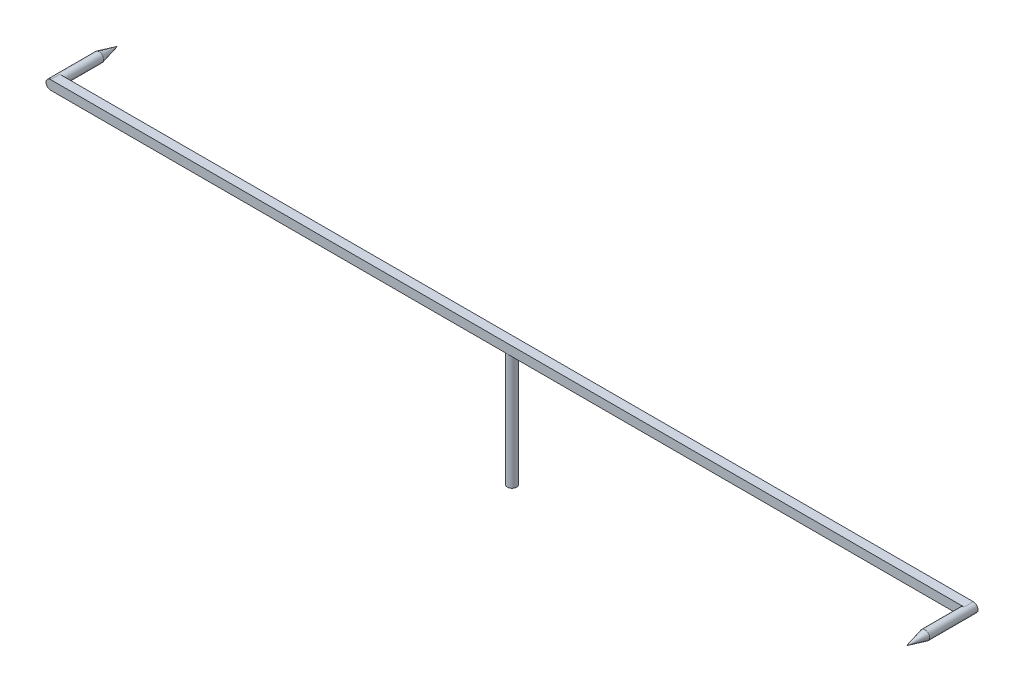
from build123d import *

# Parameters (mm, degrees)
SKETCH_1_R      = 0.4
EXTRUDE_1_DEPTH = 10
SKETCH_2_W      = 80
SKETCH_2_H      = 0.8
EXTRUDE_2_DEPTH = 0.8
FILLET_1_R      = 0.4
SKETCH_3_R      = 0.4
EXTRUDE_3_DEPTH = 3.4
SKETCH_4_R      = 0.4
EXTRUDE_4_DEPTH = 3.4


with BuildPart() as part:
    # 草图1 → 凸台-拉伸1 (new body)
    with BuildSketch(Plane(origin=(0, 0, 0), x_dir=(1, 0, 0), z_dir=(0, 1, 0))):
        with Locations(Location((0, 0, 0), (0, 0, 270))):
            Circle(SKETCH_1_R)
    extrude(amount=EXTRUDE_1_DEPTH)

    # 草图2 → 凸台-拉伸2 (add)
    with BuildSketch(Plane(origin=(0, 10, 0), x_dir=(1, 0, 0), z_dir=(0, 1, 0))):
        Rectangle(SKETCH_2_W, SKETCH_2_H)
    extrude(amount=EXTRUDE_2_DEPTH)

    # 圆角1
    fillet_1_edges = [part.edges().sort_by_distance(p)[0] for p in [
        (40, 10, 0),
        (40, 10.8, 0),
        (-40, 10, 0),
        (-40, 10.8, 0),
    ]]
    fillet(fillet_1_edges, radius=FILLET_1_R - 0.0001)  # a hair under: the kernel refuses the full size

    # 草图3 → 凸台-拉伸3 (add)
    with BuildSketch(Plane.XY.offset(0.4)):
        with Locations((39.6, 10.4)):
            Circle(SKETCH_3_R)
    extrude(amount=EXTRUDE_3_DEPTH)

    # 草图4 → 凸台-拉伸4 (add)
    with BuildSketch(Plane(origin=(0, 0, -0.4), x_dir=(-1, 0, 0), z_dir=(0, 0, -1))):
        with Locations((39.6, 10.4)):
            Circle(SKETCH_4_R)
    extrude(amount=EXTRUDE_4_DEPTH)

    # 草图5 → 旋转1 (revolve)
    with BuildSketch(Plane(origin=(0, 10.4, 0), x_dir=(1, 0, 0), z_dir=(0, 1, 0))):
        Polygon((39.6, -3.8), (39.6, -5.4), (40, -3.8), align=None)
    revolve(axis=Axis((39.6, 10.4, 3.8), (0, 0, 1)))

    # 草图6 → 旋转2 (revolve)
    with BuildSketch(Plane(origin=(0, 10.4, 0), x_dir=(1, 0, 0), z_dir=(0, 1, 0))):
        Polygon((-39.6, 3.8), (-39.6, 5.4), (-40, 3.8), align=None)
    revolve(axis=Axis((-39.6, 10.4, -3.8), (0, 0, -1)))


solid = part.part
